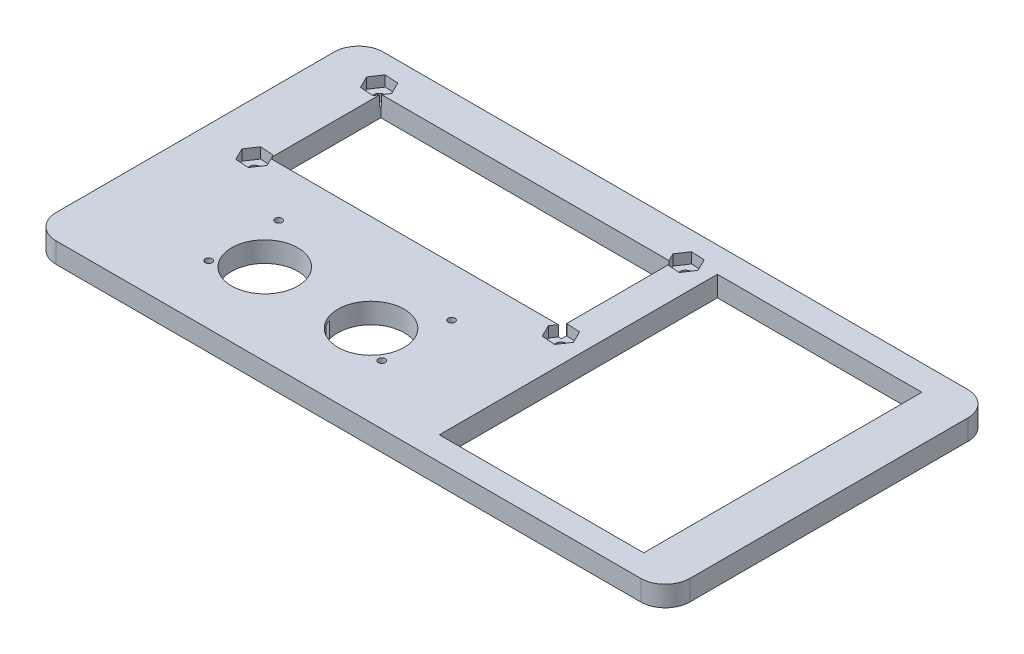
from build123d import *

# Parameters (mm, degrees)
SKETCH1_W                = 155
SKETCH1_H                = 80
BOSS_EXTRUDE1_DEPTH      = 5
SKETCH2_R                = 1.27
SKETCH2_W                = 71.2978
SKETCH2_H                = 27.1018
SCREEN_CUTOUT_DEPTH      = 88.357026048
SCREEN_HEX_NUTS_DEPTH    = 2.6
SKETCH3_R                = 8.1
SKETCH3_R_2              = 0.85
ULTRASOUND_CUTOUTS_DEPTH = 88.357026048
SKETCH5_W                = 12
SKETCH5_H                = 4
US_CLOCK_CUTOUT_DEPTH    = 4
SKETCH6_W                = 10
SKETCH6_H                = 3.5
US_PIN_CUTOUT_DEPTH      = 2
SKETCH9_R                = 3.15
MAGNET_HOLES_DEPTH       = 2.1
FILLET1_R                = 6
SKETCH10_W               = 50
SKETCH10_H               = 68
KEYPAD_CUTOUT_DEPTH      = 88.357026048


with BuildPart() as part:
    # Sketch1 → Boss-Extrude1 (new body)
    with BuildSketch(Plane(origin=(0, 0, 0), x_dir=(1, 0, 0), z_dir=(0, 1, 0))):
        Rectangle(SKETCH1_W, SKETCH1_H)
    extrude(amount=BOSS_EXTRUDE1_DEPTH)

    # Sketch2 → Screen Cutout (cut, through all)
    with BuildSketch(Plane(origin=(0, 5, 0), x_dir=(1, 0, 0), z_dir=(0, 1, 0))):
        with Locations((-64.96, 1.98)):
            Circle(SKETCH2_R)
        with Locations((9.97, 1.98)):
            Circle(SKETCH2_R)
        with Locations((9.97, 32.46)):
            Circle(SKETCH2_R)
        with Locations((-64.96, 32.46)):
            Circle(SKETCH2_R)
        with Locations((-27.2029, 17.22)):
            Rectangle(SKETCH2_W, SKETCH2_H)
    extrude(amount=-SCREEN_CUTOUT_DEPTH, mode=Mode.SUBTRACT)

    # Sketch8 → Screen hex nuts (cut)
    with BuildSketch(Plane(origin=(0, 5, 0), x_dir=(1, 0, 0), z_dir=(0, 1, 0))):
        Polygon((-66.789617219, 29.724583975), (-63.505868842, 29.507796996), (-61.676251623, 32.243213022), (-63.130382781, 35.195416025), (-66.414131158, 35.412203004), (-68.243748377, 32.676786978), align=None)
        Polygon((8.140383231, 29.724583673), (11.424131645, 29.507797236), (13.253748413, 32.243213563), (11.799616769, 35.195416327), (8.515868355, 35.412202764), (6.686251587, 32.676786437), align=None)
        Polygon((8.140382864, -0.755416081), (11.424131248, -0.97220296), (13.253748384, 1.763213121), (11.799617136, 4.715416081), (8.515868752, 4.93220296), (6.686251616, 2.196786879), align=None)
        Polygon((-66.789617161, -0.755416064), (-63.505868779, -0.972202973), (-61.676251618, 1.763213091), (-63.130382839, 4.715416064), (-66.414131221, 4.932202973), (-68.243748382, 2.196786909), align=None)
    extrude(amount=-SCREEN_HEX_NUTS_DEPTH, mode=Mode.SUBTRACT)

    # Sketch3 → Ultrasound Cutouts (cut, through all)
    with BuildSketch(Plane(origin=(0, 5, 0), x_dir=(1, 0, 0), z_dir=(0, 1, 0))):
        with Locations((-40.471992442, -20)):
            Circle(SKETCH3_R)
        with Locations((-14.471992442, -20)):
            Circle(SKETCH3_R)
        with Locations((-48.621992442, -8.45)):
            Circle(SKETCH3_R_2)
        with Locations((-6.321992442, -8.45)):
            Circle(SKETCH3_R_2)
        with Locations((-6.321992442, -25.55)):
            Circle(SKETCH3_R_2)
        with Locations((-48.621992442, -25.55)):
            Circle(SKETCH3_R_2)
    extrude(amount=-ULTRASOUND_CUTOUTS_DEPTH, mode=Mode.SUBTRACT)

    # Sketch5 → US Clock cutout (cut)
    with BuildSketch(Plane.XZ):
        with Locations((-27.471992442, 24.4)):
            Rectangle(SKETCH5_W, SKETCH5_H)
    extrude(amount=-US_CLOCK_CUTOUT_DEPTH, mode=Mode.SUBTRACT)

    # Sketch6 → US Pin cutout (cut)
    with BuildSketch(Plane.XZ):
        with Locations((-27.471992442, 9.237768387)):
            Rectangle(SKETCH6_W, SKETCH6_H)
    extrude(amount=-US_PIN_CUTOUT_DEPTH, mode=Mode.SUBTRACT)

    # Sketch9 → Magnet Holes (cut)
    with BuildSketch(Plane(origin=(0, 0.2, 0), x_dir=(-1, 0, 0), z_dir=(0, -1, 0))):
        with Locations((-71.5, 34)):
            Circle(SKETCH9_R)
        with Locations((71.5, 34)):
            Circle(SKETCH9_R)
        with Locations((-71.5, -34)):
            Circle(SKETCH9_R)
        with Locations((71.5, -34)):
            Circle(SKETCH9_R)
    extrude(amount=-MAGNET_HOLES_DEPTH, mode=Mode.SUBTRACT)

    # Fillet1
    fillet1_edges = [part.edges().sort_by_distance(p)[0] for p in [
        (77.5, 2.5, -40),
        (77.5, 2.5, 40),
        (-77.5, 2.5, 40),
        (-77.5, 2.5, -40),
    ]]
    fillet(fillet1_edges, radius=FILLET1_R)

    # Sketch10 → Keypad cutout (cut, through all)
    with BuildSketch(Plane(origin=(0, 5, 0), x_dir=(1, 0, 0), z_dir=(0, 1, 0))):
        with Locations((41.446, -0.217056096)):
            Rectangle(SKETCH10_W, SKETCH10_H)
    extrude(amount=-KEYPAD_CUTOUT_DEPTH, mode=Mode.SUBTRACT)


solid = part.part
